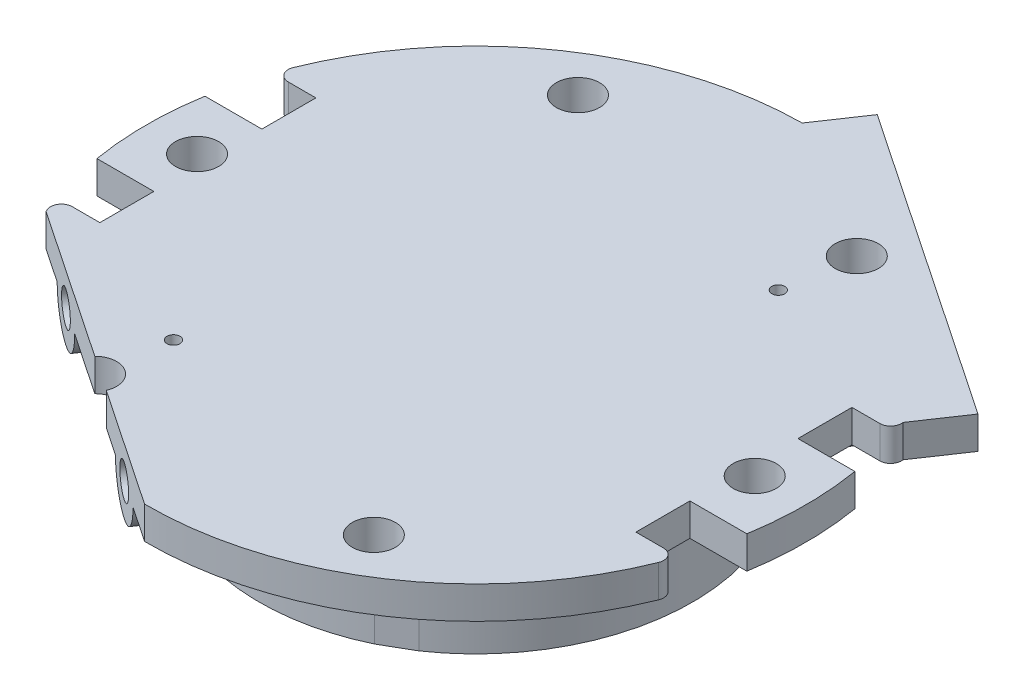
from build123d import *

# Parameters (mm, degrees)
CROQUIS1_R              = 30.5
SALIENTE_EXTRUIR1_DEPTH = 3
CORTAR_EXTRUIR3_START   = -4
CORTAR_EXTRUIR3_DEPTH   = 4
CORTAR_EXTRUIR4_DEPTH   = 10
CROQUIS8_R              = 0.6
CORTAR_EXTRUIR5_DEPTH   = 3
SALIENTE_EXTRUIR2_DEPTH = 13
CROQUIS11_W             = 34.583232932
CROQUIS11_H             = 3
SALIENTE_EXTRUIR3_DEPTH = 6
CROQUIS12_R             = 2
CORTAR_EXTRUIR7_DEPTH   = 3
SALIENTE_EXTRUIR4_DEPTH = 20
CROQUIS14_R             = 1.5
CORTAR_EXTRUIR8_DEPTH   = 6
CORTAR_EXTRUIR9_START   = -3
CORTAR_EXTRUIR9_DEPTH   = 3
CROQUIS16_W             = 33.68877148
CROQUIS16_H             = 3
SALIENTE_EXTRUIR5_DEPTH = 6
CROQUIS17_R             = 2
CORTAR_EXTRUIR10_DEPTH  = 3
CROQUIS18_R             = 3
SALIENTE_EXTRUIR6_DEPTH = 25
CROQUIS19_R             = 1.5
CORTAR_EXTRUIR11_DEPTH  = 5
CORTAR_EXTRUIR12_DEPTH  = 6
CORTAR_EXTRUIR13_DEPTH  = 6
CROQUIS22_R             = 1.5
CORTAR_EXTRUIR14_DEPTH  = 6
CROQUIS23_R             = 1.5
CORTAR_EXTRUIR15_DEPTH  = 6
REDONDEO1_R             = 1
SALIENTE_EXTRUIR7_START = 5
CROQUIS24_R             = 1.5
SALIENTE_EXTRUIR7_DEPTH = 5
CROQUIS26_R             = 2
CORTAR_EXTRUIR16_DEPTH  = 3


with BuildPart() as part:
    # Croquis1 → Saliente-Extruir1 (new body)
    with BuildSketch(Plane(origin=(0, 0, 0), x_dir=(1, 0, 0), z_dir=(0, 1, 0))):
        with Locations(Location((0, 0, 0), (0, 0, 270))):
            Circle(CROQUIS1_R)
    extrude(amount=SALIENTE_EXTRUIR1_DEPTH)

    # Croquis5 → Cortar-Extruir3 (cut)
    with BuildSketch(Plane(origin=(0, 3, 0), x_dir=(1, 0, 0), z_dir=(0, 1, 0)).offset(CORTAR_EXTRUIR3_START)):
        with BuildLine():
            ThreePointArc((-30.087372767, -5), (-29.556634924, -7.526973624), (-28.814059068, -10))
            Line((-28.814059068, -10), (-24.814059068, -10))
            Line((-24.814059068, -10), (-24.814059068, -5))
            Line((-24.814059068, -5), (-28.814059068, -5))
            Line((-28.814059068, -5), (-30.087372767, -5))
        make_face()
        with BuildLine():
            ThreePointArc((-28.814059068, 10), (-29.556634924, 7.526973624), (-30.087372767, 5))
            Line((-30.087372767, 5), (-28.814059068, 5))
            Line((-28.814059068, 5), (-24.814059068, 5))
            Line((-24.814059068, 5), (-24.814059068, 10))
            Line((-24.814059068, 10), (-28.814059068, 10))
        make_face()
        with BuildLine():
            Line((28.814059068, 5), (30.087372767, 5))
            ThreePointArc((30.087372767, 5), (29.556634924, 7.526973624), (28.814059068, 10))
            Line((28.814059068, 10), (24.814059068, 10))
            Line((24.814059068, 10), (24.814059068, 5))
            Line((24.814059068, 5), (28.814059068, 5))
        make_face()
        with BuildLine():
            Line((30.087372767, -5), (28.814059068, -5))
            Line((28.814059068, -5), (24.814059068, -5))
            Line((24.814059068, -5), (24.814059068, -10))
            Line((24.814059068, -10), (28.814059068, -10))
            ThreePointArc((28.814059068, -10), (29.556634924, -7.526973624), (30.087372767, -5))
        make_face()
    extrude(amount=CORTAR_EXTRUIR3_DEPTH, mode=Mode.SUBTRACT)

    # Croquis7 → Cortar-Extruir4 (cut)
    with BuildSketch(Plane(origin=(0, 3, 0), x_dir=(1, 0, 0), z_dir=(0, 1, 0))):
        with BuildLine():
            ThreePointArc((-13.907029535, 20.623580122), (-11.907029535, 20.623580122), (-10.907029535, 22.355630929))
            Line((-10.907029535, 22.355630929), (-12.907029535, 22.355630929))
            Line((-12.907029535, 22.355630929), (-13.907029535, 20.623580122))
        make_face()
        with BuildLine():
            Line((-12.907029535, 22.355630929), (-10.907029535, 22.355630929))
            ThreePointArc((-10.907029535, 22.355630929), (-13.907029535, 24.087681737), (-13.907029535, 20.623580122))
            Line((-13.907029535, 20.623580122), (-12.907029535, 22.355630929))
        make_face()
        with BuildLine():
            ThreePointArc((-23.81405907, 0), (-24.082008262, 1), (-24.81405907, 1.732050808))
            Line((-24.81405907, 1.732050808), (-25.81405907, 0))
            Line((-25.81405907, 0), (-24.81405907, -1.732050808))
            ThreePointArc((-24.81405907, -1.732050808), (-24.082008262, -1), (-23.81405907, 0))
        make_face()
        with BuildLine():
            Line((-25.81405907, 0), (-24.81405907, 1.732050808))
            ThreePointArc((-24.81405907, 1.732050808), (-27.81405907, 0), (-24.81405907, -1.732050808))
            Line((-24.81405907, -1.732050808), (-25.81405907, 0))
        make_face()
        with BuildLine():
            ThreePointArc((10.907029535, 22.355630929), (11.907029535, 20.623580122), (13.907029535, 20.623580122))
            Line((13.907029535, 20.623580122), (12.907029535, 22.355630929))
            Line((12.907029535, 22.355630929), (10.907029535, 22.355630929))
        make_face()
        with BuildLine():
            Line((12.907029535, 22.355630929), (13.907029535, 20.623580122))
            ThreePointArc((13.907029535, 20.623580122), (14.639080343, 21.355630929), (14.907029535, 22.355630929))
            ThreePointArc((14.907029535, 22.355630929), (12.907029535, 24.355630929), (10.907029535, 22.355630929))
            Line((10.907029535, 22.355630929), (12.907029535, 22.355630929))
        make_face()
        with BuildLine():
            Line((24.81405907, -1.732050808), (25.81405907, 0))
            Line((25.81405907, 0), (24.81405907, 1.732050808))
            ThreePointArc((24.81405907, 1.732050808), (23.81405907, 0), (24.81405907, -1.732050808))
        make_face()
        with BuildLine():
            Line((24.81405907, 1.732050808), (25.81405907, 0))
            Line((25.81405907, 0), (24.81405907, -1.732050808))
            ThreePointArc((24.81405907, -1.732050808), (26.81405907, -1.732050808), (27.81405907, 0))
            ThreePointArc((27.81405907, 0), (26.81405907, 1.732050808), (24.81405907, 1.732050808))
        make_face()
        with BuildLine():
            ThreePointArc((-13.907029535, -20.623580122), (-13.907029535, -24.087681737), (-10.907029535, -22.355630929))
            Line((-10.907029535, -22.355630929), (-12.907029535, -22.355630929))
            Line((-12.907029535, -22.355630929), (-13.907029535, -20.623580122))
        make_face()
        with BuildLine():
            Line((-12.907029535, -22.355630929), (-10.907029535, -22.355630929))
            ThreePointArc((-10.907029535, -22.355630929), (-11.907029535, -20.623580122), (-13.907029535, -20.623580122))
            Line((-13.907029535, -20.623580122), (-12.907029535, -22.355630929))
        make_face()
        with BuildLine():
            ThreePointArc((14.907029535, -22.355630929), (14.639080343, -21.355630929), (13.907029535, -20.623580122))
            Line((13.907029535, -20.623580122), (12.907029535, -22.355630929))
            Line((12.907029535, -22.355630929), (10.907029535, -22.355630929))
            ThreePointArc((10.907029535, -22.355630929), (12.907029535, -24.355630929), (14.907029535, -22.355630929))
        make_face()
        with BuildLine():
            Line((12.907029535, -22.355630929), (13.907029535, -20.623580122))
            ThreePointArc((13.907029535, -20.623580122), (11.907029535, -20.623580122), (10.907029535, -22.355630929))
            Line((10.907029535, -22.355630929), (12.907029535, -22.355630929))
        make_face()
    extrude(amount=-CORTAR_EXTRUIR4_DEPTH, mode=Mode.SUBTRACT)

    # Croquis8 → Cortar-Extruir5 (cut)
    with BuildSketch(Plane(origin=(0, 3, 0), x_dir=(1, 0, 0), z_dir=(0, 1, 0))):
        with Locations(Location((12, 16, 0), (0, 0, 270))):
            Circle(CROQUIS8_R)
        with Locations(Location((-12, -16, 0), (0, 0, 270))):
            Circle(CROQUIS8_R)
    extrude(amount=-CORTAR_EXTRUIR5_DEPTH, mode=Mode.SUBTRACT)

    # Croquis9 → Saliente-Extruir2 (add)
    with BuildSketch(Plane(origin=(0, 3, 0), x_dir=(1, 0, 0), z_dir=(0, 1, 0))):
        with BuildLine():
            Line((-8.700961894, 18.070508076), (-10, 17.320508076))
            Line((-10, 17.320508076), (-11.299038106, 16.570508076))
            ThreePointArc((-11.299038106, 16.570508076), (-19.960969499, 1.951844427), (-14.294950117, -14.067849912))
            ThreePointArc((-14.294950117, -14.067849912), (-10.97161543, -13.181769141), (-9, -16))
            ThreePointArc((-9, -16), (-9.12838457, -16.868230859), (-9.502549883, -17.662150088))
            ThreePointArc((-9.502549883, -17.662150088), (-0.449805389, -20.05112653), (8.700961894, -18.070508076))
            Line((8.700961894, -18.070508076), (10, -17.320508076))
            Line((10, -17.320508076), (11.299038106, -16.570508076))
            ThreePointArc((11.299038106, -16.570508076), (17.732250869, -9.371087404), (20.05617112, 0))
            ThreePointArc((20.05617112, 0), (18.560064193, 7.600922125), (14.294950117, 14.067849912))
            ThreePointArc((14.294950117, 14.067849912), (10.2, 13.6), (9.502549883, 17.662150088))
            ThreePointArc((9.502549883, 17.662150088), (0.449805389, 20.05112653), (-8.700961894, 18.070508076))
        make_face()
    extrude(amount=-SALIENTE_EXTRUIR2_DEPTH)

    # Croquis11 → Saliente-Extruir3 (add)
    with BuildSketch(Plane(origin=(14.04954782, 0, -20.829311224), x_dir=(-0.8290375725550414, 0, -0.5591929034707472), z_dir=(0.5591929034707472, 0, -0.8290375725550414))):
        with Locations((0, 1.5)):
            Rectangle(CROQUIS11_W, CROQUIS11_H)
    extrude(amount=SALIENTE_EXTRUIR3_DEPTH)

    # Croquis12 → Cortar-Extruir7 (cut)
    with BuildSketch(Plane(origin=(0, 3, 0), x_dir=(1, 0, 0), z_dir=(0, 1, 0))):
        with Locations(Location((12.907029535, 22.355630929, 0), (0, 0, 270))):
            Circle(CROQUIS12_R)
    extrude(amount=-CORTAR_EXTRUIR7_DEPTH, mode=Mode.SUBTRACT)

    # Croquis13 → Saliente-Extruir4 (add)
    with BuildSketch(Plane(origin=(17.404705241, 0, -25.803536659), x_dir=(-0.8290375725550414, 0, -0.5591929034707472), z_dir=(0.5591929034707472, 0, -0.8290375725550414))):
        with BuildLine():
            ThreePointArc((10, 3), (7.878679656, 2.121320344), (7, 0))
            Line((7, 0), (8.5, 0))
            ThreePointArc((8.5, 0), (10, 1.5), (11.5, 0))
            Line((11.5, 0), (13, 0))
            ThreePointArc((13, 0), (12.121320344, 2.121320344), (10, 3))
        make_face()
        with BuildLine():
            Line((8.5, 0), (7, 0))
            ThreePointArc((7, 0), (10, -3), (13, 0))
            Line((13, 0), (11.5, 0))
            ThreePointArc((11.5, 0), (10, -1.5), (8.5, 0))
        make_face()
        with BuildLine():
            ThreePointArc((-11.5, 0), (-10, 1.5), (-8.5, 0))
            Line((-8.5, 0), (-7, 0))
            ThreePointArc((-7, 0), (-7.878679656, 2.121320343), (-9.999999999, 3))
            ThreePointArc((-9.999999999, 3), (-12.121320343, 2.121320344), (-13, 0))
            Line((-13, 0), (-11.5, 0))
        make_face()
        with BuildLine():
            Line((-7, 0), (-8.5, 0))
            ThreePointArc((-8.5, 0), (-10, -1.5), (-11.5, 0))
            Line((-11.5, 0), (-13, 0))
            ThreePointArc((-13, 0), (-10, -3), (-7, 0))
        make_face()
        with BuildLine():
            ThreePointArc((-11.5, 0), (-10, -1.5), (-8.5, 0))
            Line((-8.5, 0), (-11.5, 0))
        make_face()
        with BuildLine():
            Line((-11.5, 0), (-8.5, 0))
            ThreePointArc((-8.5, 0), (-10, 1.5), (-11.5, 0))
        make_face()
        with BuildLine():
            ThreePointArc((11.5, 0), (10, 1.5), (8.5, 0))
            Line((8.5, 0), (11.5, 0))
        make_face()
        with BuildLine():
            Line((11.5, 0), (8.5, 0))
            ThreePointArc((8.5, 0), (10, -1.5), (11.5, 0))
        make_face()
    extrude(amount=-SALIENTE_EXTRUIR4_DEPTH)

    # Croquis14 → Cortar-Extruir8 (cut)
    with BuildSketch(Plane(origin=(17.404705241, 0, -25.803536659), x_dir=(-0.8290375725550414, 0, -0.5591929034707472), z_dir=(0.5591929034707472, 0, -0.8290375725550414))):
        with Locations((-10, 0)):
            Circle(CROQUIS14_R)
        with Locations((10, 0)):
            Circle(CROQUIS14_R)
    extrude(amount=-CORTAR_EXTRUIR8_DEPTH, mode=Mode.SUBTRACT)

    # Croquis15 → Cortar-Extruir9 (cut)
    with BuildSketch(Plane(origin=(0, 3, 0), x_dir=(1, 0, 0), z_dir=(0, 1, 0)).offset(CORTAR_EXTRUIR9_START)):
        with BuildLine():
            ThreePointArc((-28.212513648, -11.588963441), (-17.055383556, -25.285645963), (-0.176506165, -30.499489267))
            Line((-0.176506165, -30.499489267), (-11.071782568, -23.15053254))
            ThreePointArc((-11.071782568, -23.15053254), (-14.025415342, -24.013706075), (-14.331545089, -20.951794957))
            Line((-14.331545089, -20.951794957), (-28.212513648, -11.588963441))
        make_face()
    extrude(amount=CORTAR_EXTRUIR9_DEPTH, mode=Mode.SUBTRACT)

    # Croquis16 → Saliente-Extruir5 (add)
    with BuildSketch(Plane(origin=(-14.194509906, 0, 21.044226354), x_dir=(0.8290375725550415, 0, 0.5591929034707472), z_dir=(-0.5591929034707471, 0, 0.8290375725550414))):
        with Locations((-0.064381976, 1.5)):
            Rectangle(CROQUIS16_W, CROQUIS16_H)
    extrude(amount=SALIENTE_EXTRUIR5_DEPTH)

    # Croquis17 → Cortar-Extruir10 (cut)
    with BuildSketch(Plane(origin=(0, 3, 0), x_dir=(1, 0, 0), z_dir=(0, 1, 0))):
        with Locations(Location((-12.907029535, -22.355630929, 0), (0, 0, 270))):
            Circle(CROQUIS17_R)
    extrude(amount=-CORTAR_EXTRUIR10_DEPTH, mode=Mode.SUBTRACT)

    # Croquis18 → Saliente-Extruir6 (add)
    with BuildSketch(Plane(origin=(-17.549667327, 0, 26.01845179), x_dir=(0.8290375725550416, 0, 0.5591929034707471), z_dir=(-0.5591929034707471, 0, 0.8290375725550416))):
        with Locations((9.935618024, 0)):
            Circle(CROQUIS18_R)
        with Locations((-10.064381976, 0)):
            Circle(CROQUIS18_R)
    extrude(amount=-SALIENTE_EXTRUIR6_DEPTH)

    # Croquis19 → Cortar-Extruir11 (cut)
    with BuildSketch(Plane(origin=(-17.549667327, 0, 26.01845179), x_dir=(0.8290375725550416, 0, 0.5591929034707471), z_dir=(-0.5591929034707471, 0, 0.8290375725550416))):
        with Locations((-10.064381976, 0)):
            Circle(CROQUIS19_R)
        with Locations((9.935618024, 0)):
            Circle(CROQUIS19_R)
    extrude(amount=-CORTAR_EXTRUIR11_DEPTH, mode=Mode.SUBTRACT)

    # Croquis20 → Cortar-Extruir12 (cut)
    with BuildSketch(Plane(origin=(17.404705241, 0, -25.803536659), x_dir=(-0.8290375725550413, 0, -0.5591929034707475), z_dir=(0.5591929034707475, 0, -0.8290375725550414))):
        with BuildLine():
            Line((17.291616466, 3), (17.291616466, 0))
            Line((17.291616466, 0), (13, 0))
            ThreePointArc((13, 0), (10, -3), (7, 0))
            Line((7, 0), (-7, 0))
            ThreePointArc((-7, 0), (-10, -3), (-13, 0))
            Line((-13, 0), (-17.291616466, 0))
            Line((-17.291616466, 0), (-17.291616466, 3))
            Line((-17.291616466, 3), (17.291616466, 3))
        make_face()
    extrude(amount=-CORTAR_EXTRUIR12_DEPTH, mode=Mode.SUBTRACT)

    # Croquis21 → Cortar-Extruir13 (cut)
    with BuildSketch(Plane(origin=(-17.549667327, 0, 26.01845179), x_dir=(0.8290375725550416, 0, 0.5591929034707471), z_dir=(-0.5591929034707471, 0, 0.8290375725550416))):
        with BuildLine():
            Line((-13.064381976, 0), (-16.908767716, 0))
            Line((-16.908767716, 0), (-16.908767716, 3))
            Line((-16.908767716, 3), (16.780003764, 3))
            Line((16.780003764, 3), (16.780003764, 0))
            Line((16.780003764, 0), (12.935618024, 0))
            ThreePointArc((12.935618024, 0), (9.935618024, -3), (6.935618024, 0))
            Line((6.935618024, 0), (-7.064381976, 0))
            ThreePointArc((-7.064381976, 0), (-10.064381976, -3), (-13.064381976, 0))
        make_face()
    extrude(amount=-CORTAR_EXTRUIR13_DEPTH, mode=Mode.SUBTRACT)

    # Croquis22 → Cortar-Extruir14 (cut)
    with BuildSketch(Plane(origin=(-14.194509906, 0, 21.044226354), x_dir=(0.8290375725550415, 0, 0.5591929034707471), z_dir=(-0.5591929034707471, 0, 0.8290375725550415))):
        with Locations((-10.064381976, 0)):
            Circle(CROQUIS22_R)
        with Locations((9.935618024, 0)):
            Circle(CROQUIS22_R)
    extrude(amount=-CORTAR_EXTRUIR14_DEPTH, mode=Mode.SUBTRACT)

    # Croquis23 → Cortar-Extruir15 (cut)
    with BuildSketch(Plane(origin=(14.04954782, 0, -20.829311224), x_dir=(-0.8290375725550414, 0, -0.5591929034707472), z_dir=(0.5591929034707472, 0, -0.8290375725550414))):
        with Locations((-10, 0)):
            Circle(CROQUIS23_R)
        with Locations((10, 0)):
            Circle(CROQUIS23_R)
    extrude(amount=-CORTAR_EXTRUIR15_DEPTH, mode=Mode.SUBTRACT)

    # Redondeo1
    # the kernel refuses this fillet: 1 mm, written as the material it takes off along each edge
    with BuildSketch(Plane(origin=(-28.814059068, -3.664646039, 10), x_dir=(0.3504763124105457, 0, 0.9365715960027324), z_dir=(0, 1, 0))) as redondeo1_piece_1:
        with BuildLine():
            CenterArc((1.44182795, 0.999711227), REDONDEO1_R, 159.48354873, 111.893428089)
            Line((0.505256354, 1.350187539), (0.486524922, 1.357197065))
            Line((0.486524922, 1.357197065), (-0.018731432, 0.007009526))
            Line((-0.018731432, 0.007009526), (-0.000480609, -0.019994225))
            ThreePointArc((-0.000480609, -0.019994225), (0.732929208, -0.028807587), (1.466339025, -0.019994225))
            Line((1.466339025, -0.019994225), (1.465858416, 0))
        make_face()
    extrude(amount=10.329292079, mode=Mode.SUBTRACT)
    with BuildSketch(Plane(origin=(-28.814059068, -3.664646039, -10), x_dir=(1, 0, 0), z_dir=(0, 1, 0))) as redondeo1_piece_2:
        with BuildLine():
            CenterArc((1.441627682, 1), REDONDEO1_R, 158.106571911, 111.893428089)
            Line((0.513748652, 1.372881356), (0.495191071, 1.380338983))
            ThreePointArc((0.495191071, 1.380338983), (0.229893958, 0.696537055), (-0.018894465, 0.006557377))
            Line((-0.018894465, 0.006557377), (0, -0.02))
            Line((0, -0.02), (1.441627682, -0.02))
            Line((1.441627682, -0.02), (1.441627682, 0))
        make_face()
    extrude(amount=10.329292079, mode=Mode.SUBTRACT)
    with BuildSketch(Plane(origin=(28.814059068, -3.540586699, -10), x_dir=(-1, 0, 0), z_dir=(0, 1, 0))) as redondeo1_piece_3:
        with BuildLine():
            CenterArc((1.41623468, -1), REDONDEO1_R, 90, 99.20469094)
            Line((0.429111508, -1.159962006), (0.409369044, -1.163161246))
            ThreePointArc((0.409369044, -1.163161246), (0.189917894, -0.58909543), (-0.018894465, -0.006557377))
            Line((-0.018894465, -0.006557377), (0, 0.02))
            Line((0, 0.02), (1.41623468, 0.02))
            Line((1.41623468, 0.02), (1.41623468, 0))
        make_face()
    extrude(amount=10.081173399, mode=Mode.SUBTRACT)
    with BuildSketch(Plane(origin=(28.814059068, -3.664646039, 10), x_dir=(-0.35047631241054894, 0, 0.9365715960027313), z_dir=(0, 1, 0))) as redondeo1_piece_4:
        with BuildLine():
            CenterArc((1.44182795, -0.999711227), REDONDEO1_R, 88.623023181, 111.893428089)
            Line((0.505256354, -1.350187539), (0.486524922, -1.357197065))
            Line((0.486524922, -1.357197065), (-0.018731432, -0.007009526))
            Line((-0.018731432, -0.007009526), (-0.000480609, 0.019994225))
            ThreePointArc((-0.000480609, 0.019994225), (0.732929208, 0.028807587), (1.466339025, 0.019994225))
            Line((1.466339025, 0.019994225), (1.465858416, 0))
        make_face()
    extrude(amount=10.329292079, mode=Mode.SUBTRACT)

    # Croquis24 → Saliente-Extruir7 (add)
    with BuildSketch(Plane(origin=(14.04954782, 0, -20.829311224), x_dir=(-0.8290375725550414, 0, -0.5591929034707472), z_dir=(0.5591929034707472, 0, -0.8290375725550414)).offset(SALIENTE_EXTRUIR7_START)):
        with BuildLine():
            Line((17.291616466, 3), (-17.291616466, 3))
            Line((-17.291616466, 3), (-17.291616466, 0))
            Line((-17.291616466, 0), (-13, 0))
            ThreePointArc((-13, 0), (-10, -3), (-7, 0))
            Line((-7, 0), (7, 0))
            ThreePointArc((7, 0), (10, -3), (13, 0))
            Line((13, 0), (17.291616466, 0))
            Line((17.291616466, 0), (17.291616466, 3))
        make_face()
        with Locations((10, 0)):
            Circle(CROQUIS24_R, mode=Mode.SUBTRACT)
        with Locations((-10, 0)):
            Circle(CROQUIS24_R, mode=Mode.SUBTRACT)
    extrude(amount=-SALIENTE_EXTRUIR7_DEPTH)

    # Croquis26 → Cortar-Extruir16 (cut)
    with BuildSketch(Plane(origin=(0, 3, 0), x_dir=(1, 0, 0), z_dir=(0, 1, 0))):
        with Locations(Location((12.907029535, 22.355630929, 0), (0, 0, 270))):
            Circle(CROQUIS26_R)
    extrude(amount=-CORTAR_EXTRUIR16_DEPTH, mode=Mode.SUBTRACT)


solid = part.part
